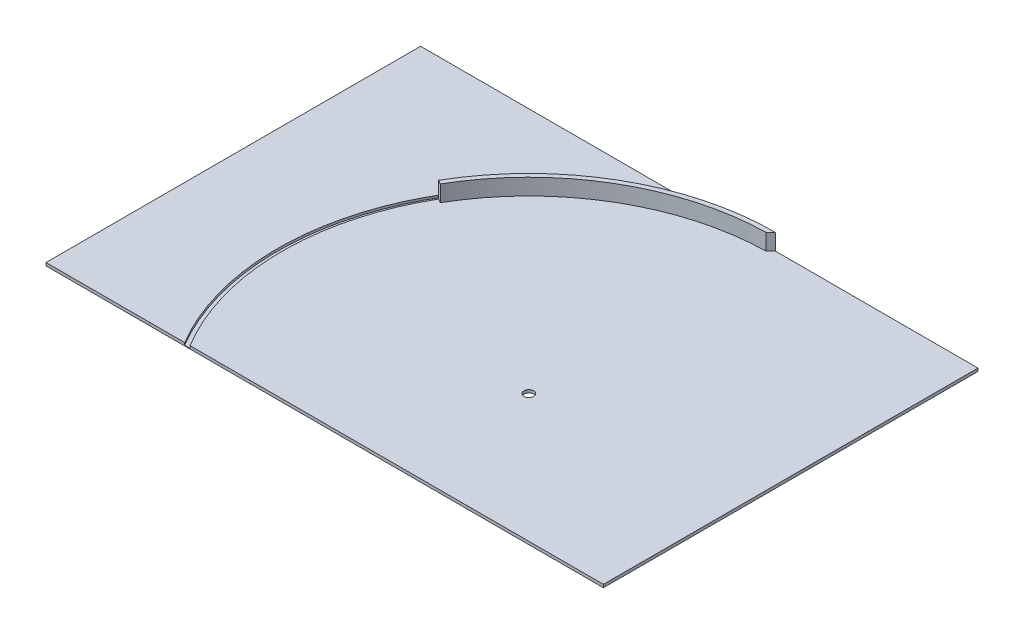
from build123d import *

# Parameters (mm, degrees)
BOSS_EXTRUDE1_DEPTH    = 35
SKETCH4_W              = 1200
SKETCH4_H              = 806.4
BOSS_EXTRUDE2_DEPTH    = 6.35
CHAMFER1_SIZE          = 10
F_20_0MM_DOWEL_HOLE1_D = 21
CUT_EXTRUDE1_START     = -5
CUT_EXTRUDE1_DEPTH     = 5


with BuildPart() as part:
    # Sketch3 → Boss-Extrude1 (new body)
    with BuildSketch(Plane(origin=(0, 0, 0), x_dir=(1, 0, 0), z_dir=(0, 1, 0))):
        with BuildLine():
            Line((0, 531), (0, 521))
            ThreePointArc((0, 521), (-260.5, 451.199235372), (-451.199235372, 260.5))
            Line((-451.199235372, 260.5), (-459.85948941, 265.5))
            ThreePointArc((-459.85948941, 265.5), (-265.5, 459.85948941), (0, 531))
        make_face()
    extrude(amount=BOSS_EXTRUDE1_DEPTH)

    # Sketch4 → Boss-Extrude2 (add)
    with BuildSketch(Plane(origin=(0, 0, 0), x_dir=(1, 0, 0), z_dir=(0, 1, 0))):
        with Locations((-164.07, 127.8)):
            Rectangle(SKETCH4_W, SKETCH4_H)
    extrude(amount=-BOSS_EXTRUDE2_DEPTH)

    # Chamfer1
    # the kernel refuses this chamfer: 10 mm, written as the material it takes off along each edge
    with BuildSketch(Plane(origin=(0, 0, -521), x_dir=(-0.999953038196086, 0, 0.009691305506332204), z_dir=(0, 1, 0))) as chamfer1_piece_1:
        with BuildLine():
            Line((10.098340338, 0), (-CHAMFER1_SIZE * 0.00969130550632, -CHAMFER1_SIZE * 0.999953038196))
            Line((-CHAMFER1_SIZE * 0.00969130550632, -CHAMFER1_SIZE * 0.999953038196), (0, 0))
            ThreePointArc((0, 0), (5.192000536, -0.024447522), (10.098340338, 0))
        make_face()
    extrude(amount=60.969219121, mode=Mode.SUBTRACT)

    # Ø20.0mm Dowel Hole1 (through all)
    with Locations(Plane(origin=(0, 0, 0), x_dir=(1, 0, 0), z_dir=(0, 1, 0))):
        with Locations((0, 0)):
            Hole(F_20_0MM_DOWEL_HOLE1_D / 2)

    # Sketch8 → Cut-Extrude1 (cut)
    with BuildSketch(Plane(origin=(0, 0, 0), x_dir=(1, 0, 0), z_dir=(0, 1, 0)).offset(CUT_EXTRUDE1_START)):
        with BuildLine():
            Line((-462.549726308, -280.586440678), (-453.999823789, -275.4))
            ThreePointArc((-453.999823789, -275.4), (-462.708547576, 260.502975031), (0, 531))
            Line((0, 531), (0, 541))
            ThreePointArc((0, 541), (-471.422456193, 265.408869099), (-462.549726308, -280.586440678))
        make_face()
    extrude(amount=CUT_EXTRUDE1_DEPTH, mode=Mode.SUBTRACT)


solid = part.part
